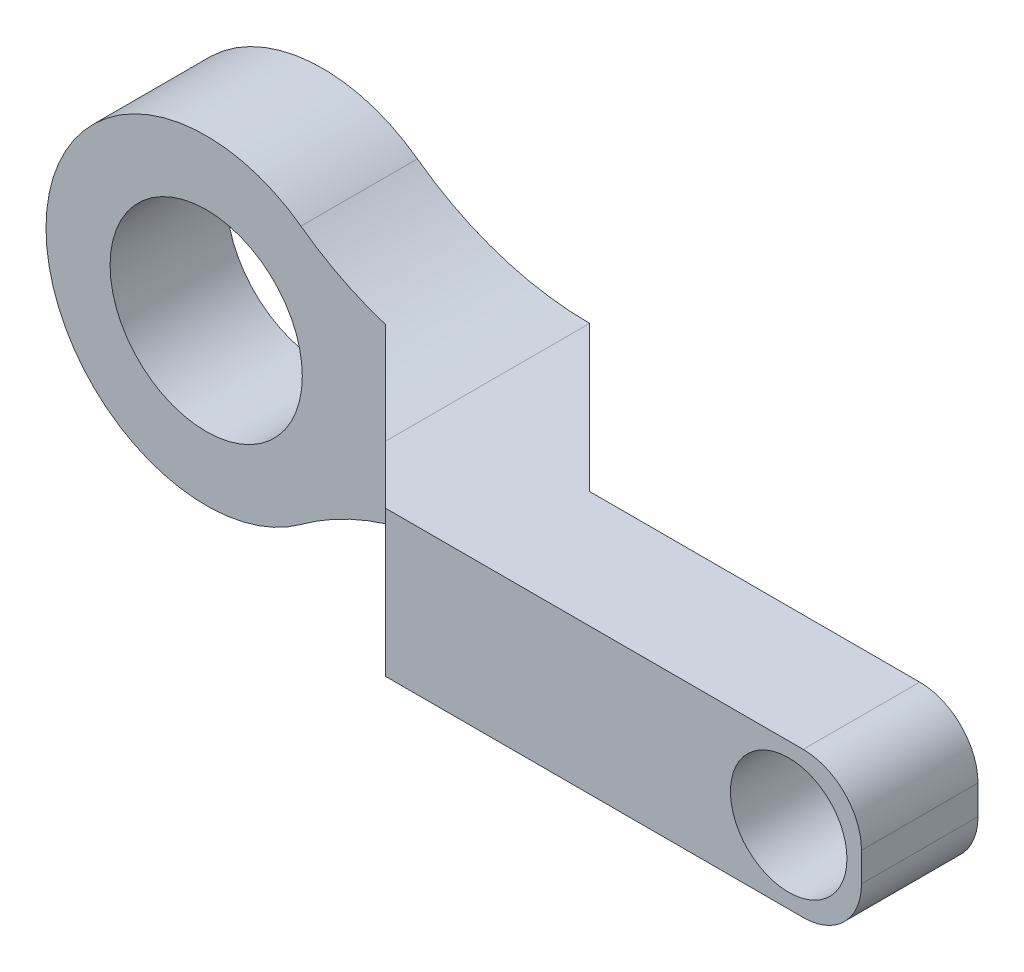
from build123d import *

# Parameters (mm, degrees)
SKETCH_1_R          = 2
EXTRUDE_1_DEPTH     = 4
FILLET_1_R          = 10
FILLET_2_R          = 2
SKETCH_8_R          = 3.300000000000001
EXTRUDE_3_DEPTH     = 5
CHAMFER_1_SIZE      = 5
SKETCH_9_R          = 3.300000000000001
CUT_EXTRUDE_3_DEPTH = 5
CHAMFER_2_SIZE      = 5


with BuildPart() as part:
    # ｽｹｯﾁ1 → ﾎﾞｽ - 押し出し1 (new body)
    # profile 1 of 5: a face of its own
    with BuildSketch(Plane.XY):
        with BuildLine():
            ThreePointArc((-27.5, 2.1540659228538024), (-27.33345237791561, 2.333452377915602), (-27.15406592285381, 2.49999999999999))
            Line((-27.154065922853814, 2.499999999999997), (-27.499999999999996, 2.499999999999997))
            Line((-27.499999999999996, 2.499999999999997), (-27.499999999999996, 2.154065922853802))
        make_face()
    # profile 2 of 5: a face of its own
    with BuildSketch(Plane.XY):
        with BuildLine():
            Line((-27.5, -2.500000000000003), (-27.154065922853817, -2.500000000000003))
            ThreePointArc((-27.154065922853817, -2.499999999999992), (-27.333452377915613, -2.3334523779156044), (-27.5, -2.1540659228538055))
            Line((-27.5, -2.1540659228538055), (-27.5, -2.500000000000003))
        make_face()
    # profile 3 of 5: a face of its own
    with BuildSketch(Plane.XY):
        with BuildLine():
            ThreePointArc((-20.10102051443362, 2.49999999999994), (-30.499999999999996, -2.39e-15), (-20.101020514433618, -2.4999999999999454))
            Line((-20.1010205144336, -2.500000000000002), (-22.84593407714621, -2.5000000000000027))
            ThreePointArc((-22.845934077146207, -2.5000000000000133), (-25.000000000000018, -3.3000000000000043), (-27.154065922853817, -2.499999999999992))
            Line((-27.154065922853817, -2.500000000000003), (-27.5, -2.500000000000003))
            Line((-27.5, -2.500000000000003), (-27.5, -2.1540659228538055))
            ThreePointArc((-27.5, -2.1540659228538055), (-28.3, -1.19e-15), (-27.5, 2.1540659228538024))
            Line((-27.499999999999996, 2.154065922853802), (-27.499999999999996, 2.499999999999997))
            Line((-27.499999999999996, 2.499999999999997), (-27.154065922853814, 2.499999999999997))
            ThreePointArc((-27.15406592285381, 2.49999999999999), (-25.000000000000014, 3.299999999999998), (-22.845934077146207, 2.500000000000007))
            Line((-22.84593407714621, 2.4999999999999982), (-20.1010205144336, 2.4999999999999987))
        make_face()
    # profile 4 of 5: a face of its own
    with BuildSketch(Plane.XY):
        with BuildLine():
            Line((-22.84593407714621, -2.5000000000000027), (-20.1010205144336, -2.500000000000002))
            ThreePointArc((-20.101020514433618, -2.4999999999999454), (-19.652365608485606, -1.2856151891963796), (-19.500000000000004, -4.41e-15))
            ThreePointArc((-19.500000000000004, -3.06e-15), (-19.652365608485606, 1.2856151891963756), (-20.10102051443362, 2.49999999999994))
            Line((-20.1010205144336, 2.4999999999999987), (-22.84593407714621, 2.4999999999999982))
            ThreePointArc((-22.845934077146207, 2.5000000000000067), (-22.00013187411367, 1.3750604449591433), (-21.7, -3.06e-15))
            ThreePointArc((-21.7, -3.87e-15), (-22.00013187411367, -1.3750604449591517), (-22.845934077146207, -2.5000000000000133))
        make_face()
    # profile 5 of 5: a face of its own
    with BuildSketch(Plane.XY):
        with BuildLine():
            Line((-20.1010205144336, -2.500000000000002), (2.5, -2.4999999999999996))
            Line((2.5, -2.4999999999999996), (2.499999999999999, 2.500000000000005))
            Line((2.499999999999999, 2.500000000000005), (-20.1010205144336, 2.4999999999999987))
            ThreePointArc((-20.10102051443362, 2.49999999999994), (-19.652365608485606, 1.2856151891963756), (-19.500000000000004, -3.06e-15))
            ThreePointArc((-19.500000000000004, -4.41e-15), (-19.652365608485606, -1.2856151891963796), (-20.101020514433618, -2.4999999999999454))
        make_face()
        Circle(SKETCH_1_R, mode=Mode.SUBTRACT)
    extrude(amount=EXTRUDE_1_DEPTH)

    # ﾌｨﾚｯﾄ1
    fillet_1_edges = [part.edges().sort_by_distance(p)[0] for p in [
        (-20.10102051443361, 2.4999999999999694, 2),
        (-20.10102051443361, -2.4999999999999742, 2),
    ]]
    fillet(fillet_1_edges, radius=FILLET_1_R)

    # ﾌｨﾚｯﾄ2
    fillet_2_edges = [part.edges().sort_by_distance(p)[0] for p in [
        (2.499999999999999, 2.500000000000005, 2),
        (2.5, -2.4999999999999996, 2),
    ]]
    fillet(fillet_2_edges, radius=FILLET_2_R)

    # ｽｹｯﾁ8 → ﾎﾞｽ - 押し出し3 (add)
    with BuildSketch(Plane(origin=(0, 0, 0), x_dir=(-1, 0, 0), z_dir=(0, 0, -1))):
        with BuildLine():
            Line((15.83484861008833, 2.5), (15.834848610088294, -2.500000000000004))
            ThreePointArc((15.834848610088294, -2.500000000000004), (18.945703694279587, -2.996180733770167), (21.747849506805537, -4.435483870967743))
            ThreePointArc((21.747849506805537, -4.435483870967743), (30.499999999999996, -3.06e-15), (21.747849506805537, 4.435483870967737))
            ThreePointArc((21.747849506805537, 4.435483870967737), (18.9457036942796, 2.996180733770169), (15.83484861008833, 2.5))
        make_face()
        with Locations((25, -3.06e-15)):
            Circle(SKETCH_8_R, mode=Mode.SUBTRACT)
    extrude(amount=EXTRUDE_3_DEPTH)

    # 面取り1
    chamfer_1_edges = [part.edges().sort_by_distance(p)[0] for p in [
        (-15.834848610088311, -1.78e-15, 0),
    ]]
    chamfer(chamfer_1_edges, length=CHAMFER_1_SIZE - 0.0001)  # a hair under: the kernel refuses the full size

    # ｽｹｯﾁ9 → ｶｯﾄ - 押し出し3 (cut)
    with BuildSketch(Plane.XY.offset(4)):
        with BuildLine():
            Line((-18.834848610088333, -2.960607985830548), (-18.83484861008833, 2.9606079858305425))
            ThreePointArc((-18.83484861008833, 2.9606079858305425), (-20.351950663989726, 3.5783527846792875), (-21.747849506805537, 4.435483870967737))
            ThreePointArc((-21.747849506805537, 4.435483870967737), (-30.499999999999996, -1.29e-15), (-21.747849506805537, -4.435483870967743))
            ThreePointArc((-21.747849506805537, -4.435483870967743), (-20.35195066398973, -3.5783527846792946), (-18.834848610088333, -2.960607985830548))
        make_face()
        with Locations(Location((-25, -3.06e-15, 0), (0, 0, 180))):
            Circle(SKETCH_9_R, mode=Mode.SUBTRACT)
    extrude(amount=-CUT_EXTRUDE_3_DEPTH, mode=Mode.SUBTRACT)

    # 面取り2
    chamfer_2_edges = [part.edges().sort_by_distance(p)[0] for p in [
        (-18.83484861008833, -2.66e-15, 4),
    ]]
    chamfer(chamfer_2_edges, length=CHAMFER_2_SIZE - 0.0001)  # a hair under: the kernel refuses the full size


solid = part.part
